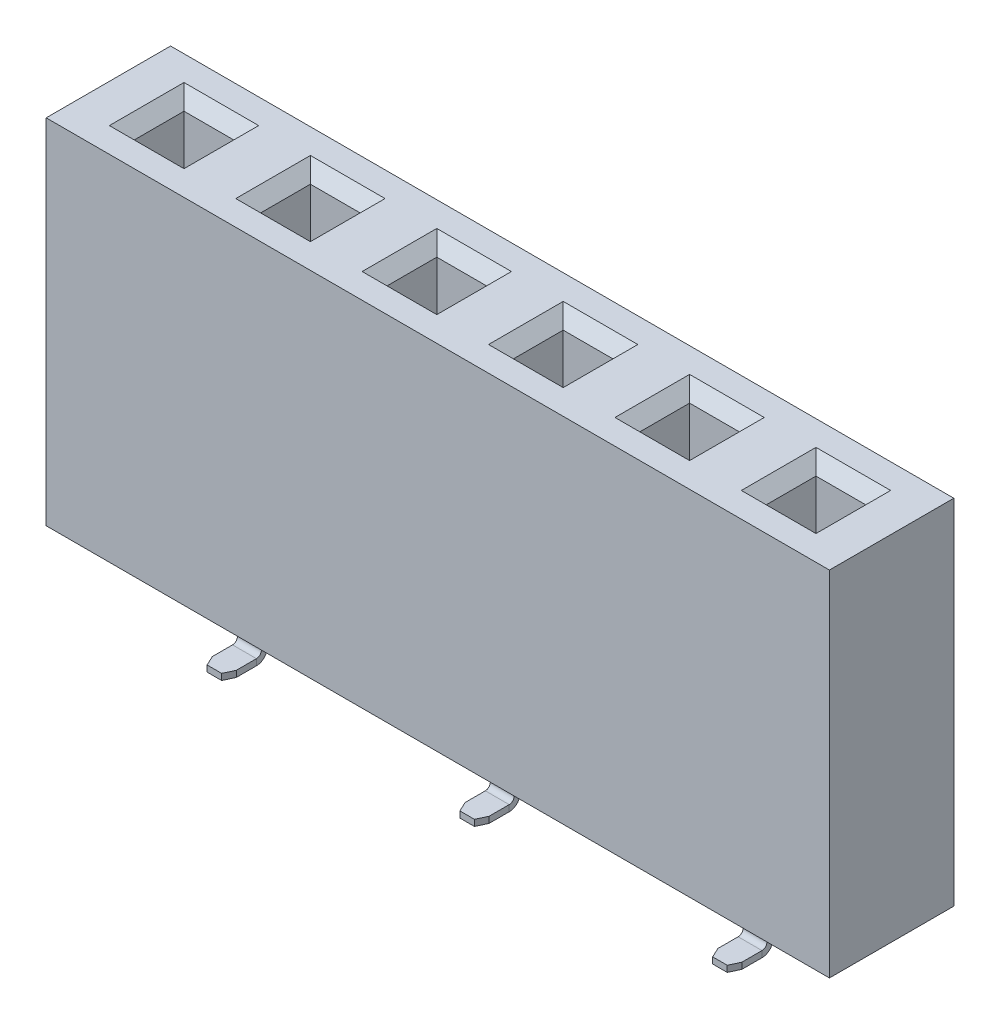
from build123d import *
from OCP.BRepFilletAPI import BRepFilletAPI_MakeChamfer

# Parameters (mm, degrees)
SKETCH1_W                  = 15.74
SKETCH1_H                  = 7.1
BOSS_EXTRUDE1_DEPTH        = 2.5
SKETCH2_W                  = 1
SKETCH2_H                  = 1
CUT_EXTRUDE1_DEPTH         = 2.5
CHAMFER1_SIZE              = 0.25
LPATTERN6_COUNT            = 6
LPATTERN6_PITCH            = 2.54
CHAMFER1_OF_LPATTERN6_SIZE = 0.25
BASE_FLANGE2_DEPTH         = 0.24
BASE_FLANGE2_DEPTH_BACK    = 0.24
BASE_FLANGE3_DEPTH         = 0.24
BASE_FLANGE3_DEPTH_BACK    = 0.24
CHAMFER3_SIZE              = 0.2
CHAMFER3_SIZE2             = 0.093261532
CHAMFER4_SIZE              = 0.2
CHAMFER4_SIZE2             = 0.093261532
LPATTERN4_COUNT            = 3
LPATTERN4_PITCH            = 5.08
LPATTERN3_COUNT            = 3
LPATTERN3_PITCH            = 5.08


# Sheet-metal steps are written as plain solids
with BuildPart() as part:
    # Sketch1 → Boss-Extrude1 (new body)
    with BuildSketch(Plane.XY):
        Rectangle(SKETCH1_W, SKETCH1_H)
    extrude(amount=BOSS_EXTRUDE1_DEPTH)

    # Sketch2 → Cut-Extrude1 (cut)
    with BuildSketch(Plane(origin=(0, 3.55, 0), x_dir=(1, 0, 0), z_dir=(0, 1, 0))):
        with Locations((-6.35, -1.25)):
            Rectangle(SKETCH2_W, SKETCH2_H)
    cut_extrude1 = extrude(amount=-CUT_EXTRUDE1_DEPTH, mode=Mode.SUBTRACT)

    # Chamfer1
    chamfer1_edges = [part.edges().sort_by_distance(p)[0] for p in [
        (-5.85, 3.55, 1.25),
        (-6.35, 3.55, 0.75),
        (-6.85, 3.55, 1.25),
        (-6.35, 3.55, 1.75),
    ]]
    chamfer(chamfer1_edges, length=CHAMFER1_SIZE)

    # LPattern6: Cut-Extrude1 ×6
    with Locations(*[(i * LPATTERN6_PITCH, 0, 0) for i in range(1, LPATTERN6_COUNT)]):
        add(cut_extrude1, mode=Mode.SUBTRACT)

    # Chamfer1 of LPattern6
    chamfer1_of_lpattern6_edges = [part.edges().sort_by_distance(p)[0] for p in [
        (-3.31, 3.55, 1.25),
        (-3.81, 3.55, 0.75),
        (-4.31, 3.55, 1.25),
        (-3.81, 3.55, 1.75),
        (-0.77, 3.55, 1.25),
        (-1.27, 3.55, 0.75),
        (-1.77, 3.55, 1.25),
        (-1.27, 3.55, 1.75),
        (1.77, 3.55, 1.25),
        (1.27, 3.55, 0.75),
        (0.77, 3.55, 1.25),
        (1.27, 3.55, 1.75),
        (4.31, 3.55, 1.25),
        (3.81, 3.55, 0.75),
        (3.31, 3.55, 1.25),
        (3.81, 3.55, 1.75),
        (6.85, 3.55, 1.25),
        (6.35, 3.55, 0.75),
        (5.85, 3.55, 1.25),
        (6.35, 3.55, 1.75),
    ]]
    chamfer(chamfer1_of_lpattern6_edges, length=CHAMFER1_OF_LPATTERN6_SIZE)


with BuildPart() as body_2:
    # Sketch5 → Base-Flange2 (new, two sides: drawn at the far end of the back side and taken through both)
    with BuildSketch(Plane.ZY.offset(6.35).offset(-BASE_FLANGE2_DEPTH_BACK)):
        with BuildLine():
            Line((0.15, -3.55), (0.15, -3.575))
            ThreePointArc((0.15, -3.575), (0.084099026, -3.734099026), (-0.075, -3.8))
            Line((-0.075, -3.8), (-0.68, -3.8))
            Line((-0.68, -3.8), (-0.68, -3.675))
            Line((-0.68, -3.675), (-0.075, -3.675))
            ThreePointArc((-0.075, -3.675), (-0.004289322, -3.645710678), (0.025, -3.575))
            Line((0.025, -3.575), (0.025, -3.55))
            Line((0.025, -3.55), (0.15, -3.55))
        make_face()
    extrude(amount=BASE_FLANGE2_DEPTH + BASE_FLANGE2_DEPTH_BACK)

    # Chamfer4: one chamfer whose edges measure the first distance from different faces: ONE call of the kernel's chamfer builder (chamfer() names one face for all edges)
    chamfer4_edges_1 = [body_2.edges().sort_by_distance(p)[0] for p in [
        (-6.11, -3.7375, -0.68),
    ]]
    chamfer4_side_1 = [body_2.faces().sort_by_distance(p)[0] for p in [
        (-6.11, -3.717002494, -0.245845427),
    ]]
    chamfer4_edges_2 = [body_2.edges().sort_by_distance(p)[0] for p in [
        (-6.59, -3.7375, -0.68),
    ]]
    chamfer4_side_2 = [body_2.faces().sort_by_distance(p)[0] for p in [
        (-6.59, -3.717002494, -0.245845427),
    ]]
    chamfer4 = BRepFilletAPI_MakeChamfer(body_2.part.solid().wrapped)
    for e in chamfer4_edges_1:
        chamfer4.Add(CHAMFER4_SIZE, CHAMFER4_SIZE2, e.wrapped, chamfer4_side_1[0].wrapped)  # the first distance lies on this face
    for e in chamfer4_edges_2:
        chamfer4.Add(CHAMFER4_SIZE, CHAMFER4_SIZE2, e.wrapped, chamfer4_side_2[0].wrapped)  # the first distance lies on this face
    add(Compound.cast(chamfer4.Shape()), mode=Mode.REPLACE)


with BuildPart() as body_3:
    # Sketch22 → Base-Flange3 (new, two sides: drawn at the far end of the back side and taken through both)
    with BuildSketch(Plane.ZY.offset(3.81).offset(-BASE_FLANGE3_DEPTH_BACK)):
        with BuildLine():
            Line((2.35, -3.55), (2.35, -3.575))
            ThreePointArc((2.35, -3.575), (2.415900974, -3.734099026), (2.575, -3.8))
            Line((2.575, -3.8), (3.18, -3.8))
            Line((3.18, -3.8), (3.18, -3.675))
            Line((3.18, -3.675), (2.575, -3.675))
            ThreePointArc((2.575, -3.675), (2.504289322, -3.645710678), (2.475, -3.575))
            Line((2.475, -3.575), (2.475, -3.55))
            Line((2.475, -3.55), (2.35, -3.55))
        make_face()
    extrude(amount=BASE_FLANGE3_DEPTH + BASE_FLANGE3_DEPTH_BACK)

    # Chamfer3: one chamfer whose edges measure the first distance from different faces: ONE call of the kernel's chamfer builder (chamfer() names one face for all edges)
    chamfer3_edges_1 = [body_3.edges().sort_by_distance(p)[0] for p in [
        (-3.57, -3.7375, 3.18),
    ]]
    chamfer3_side_1 = [body_3.faces().sort_by_distance(p)[0] for p in [
        (-3.57, -3.717002494, 2.745845427),
    ]]
    chamfer3_edges_2 = [body_3.edges().sort_by_distance(p)[0] for p in [
        (-4.05, -3.7375, 3.18),
    ]]
    chamfer3_side_2 = [body_3.faces().sort_by_distance(p)[0] for p in [
        (-4.05, -3.717002494, 2.745845427),
    ]]
    chamfer3 = BRepFilletAPI_MakeChamfer(body_3.part.solid().wrapped)
    for e in chamfer3_edges_1:
        chamfer3.Add(CHAMFER3_SIZE, CHAMFER3_SIZE2, e.wrapped, chamfer3_side_1[0].wrapped)  # the first distance lies on this face
    for e in chamfer3_edges_2:
        chamfer3.Add(CHAMFER3_SIZE, CHAMFER3_SIZE2, e.wrapped, chamfer3_side_2[0].wrapped)  # the first distance lies on this face
    add(Compound.cast(chamfer3.Shape()), mode=Mode.REPLACE)


with BuildPart() as lpattern4_1:
    # LPattern4: pattern copy
    add(body_2.part.moved(Location(Vector(1, 0, 0) * (1 * LPATTERN4_PITCH))))


with BuildPart() as lpattern4_2:
    # LPattern4: pattern copy
    add(body_2.part.moved(Location(Vector(1, 0, 0) * (2 * LPATTERN4_PITCH))))


with BuildPart() as lpattern3_1:
    # LPattern3: pattern copy
    add(body_3.part.moved(Location(Vector(1, 0, 0) * (1 * LPATTERN3_PITCH))))


with BuildPart() as lpattern3_2:
    # LPattern3: pattern copy
    add(body_3.part.moved(Location(Vector(1, 0, 0) * (2 * LPATTERN3_PITCH))))


solid = Compound([part.part, body_2.part, body_3.part, lpattern4_1.part, lpattern4_2.part, lpattern3_1.part, lpattern3_2.part])
